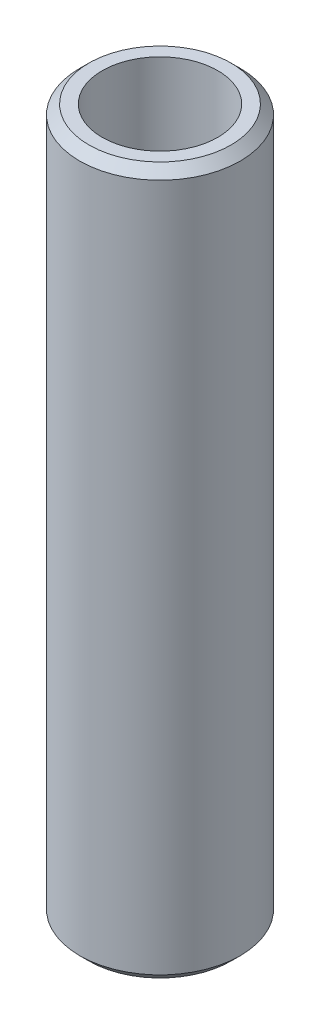
from build123d import *

# Parameters (mm, degrees)
SKETCH1_R           = 30
BOSS_EXTRUDE1_DEPTH = 264.016407434
SKETCH2_R           = 21.593593336
CUT_EXTRUDE1_DEPTH  = 268.403559053
CHAMFER1_SIZE       = 3.460403022


with BuildPart() as part:
    # Sketch1 → Boss-Extrude1 (new body)
    with BuildSketch(Plane(origin=(0, 0, 0), x_dir=(1, 0, 0), z_dir=(0, 1, 0))):
        Circle(SKETCH1_R)
    extrude(amount=BOSS_EXTRUDE1_DEPTH)

    # Sketch2 → Cut-Extrude1 (cut, through all)
    with BuildSketch(Plane(origin=(0, 0, 0), x_dir=(1, 0, 0), z_dir=(0, 1, 0))):
        Circle(SKETCH2_R)
    extrude(amount=CUT_EXTRUDE1_DEPTH, mode=Mode.SUBTRACT)

    # Chamfer1
    chamfer1_edges = [part.edges().sort_by_distance(p)[0] for p in [
        (-30, 264.016407434, 0),
        (-30, 0, 0),
    ]]
    chamfer(chamfer1_edges, length=CHAMFER1_SIZE)


solid = part.part
